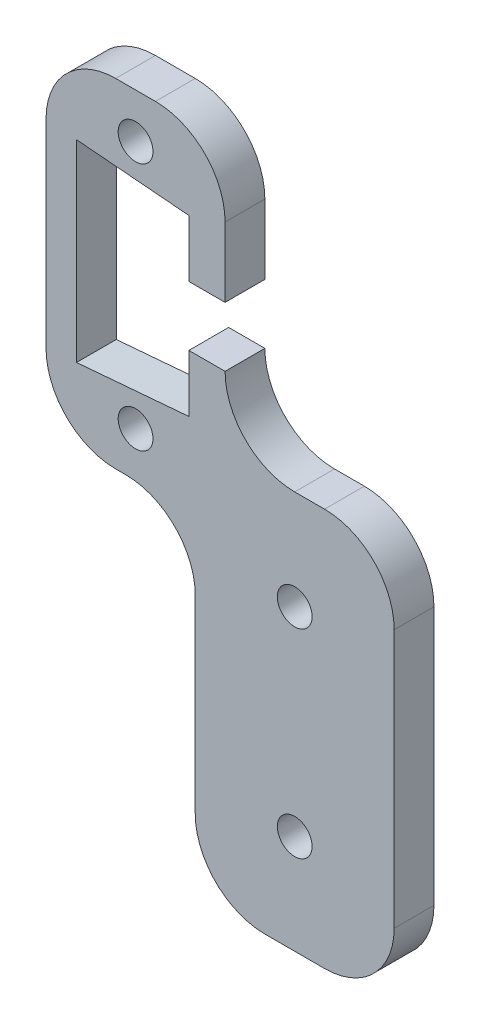
from build123d import *

# Parameters (mm, degrees)
ESBO_O1_R                = 1.75
RESSALTO_EXTRUS_O1_DEPTH = 4
FILETE2_R                = 7


with BuildPart() as part:
    # Esboço1 → Ressalto-extrusão1 (new body)
    with BuildSketch(Plane.XY):
        Polygon((-9, -17), (6, -17), (6, -50), (26, -50), (26, -10), (9, -10), (9, -3), (5.359078591, -3), (5.359078591, -8.75), (-5.940921409, -9.7), (-5.940921409, 9.7), (5.359078591, 8.75), (5.359078591, 3), (9, 3), (9, 17), (-9, 17), align=None)
        with Locations((16, -40)):
            Circle(ESBO_O1_R, mode=Mode.SUBTRACT)
        with Locations((16, -20)):
            Circle(ESBO_O1_R, mode=Mode.SUBTRACT)
        with Locations((0, -12.5)):
            Circle(ESBO_O1_R, mode=Mode.SUBTRACT)
        with Locations((0, 12.5)):
            Circle(ESBO_O1_R, mode=Mode.SUBTRACT)
    extrude(amount=RESSALTO_EXTRUS_O1_DEPTH)

    # Filete2
    filete2_edges = [part.edges().sort_by_distance(p)[0] for p in [
        (6, -50, 2),
        (6, -17, 2),
        (-9, -17, 2),
        (-9, 17, 2),
        (9, 17, 2),
        (9, -10, 2),
        (26, -10, 2),
        (26, -50, 2),
    ]]
    fillet(filete2_edges, radius=FILETE2_R - 0.0001)  # a hair under: the kernel refuses the full size


solid = part.part
